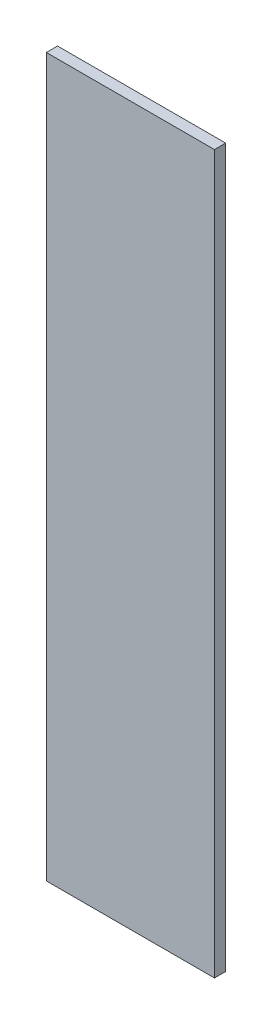
from build123d import *

# Parameters (mm, degrees)
SKETCH1_W           = 75
SKETCH1_H           = 320
BOSS_EXTRUDE1_DEPTH = 5


with BuildPart() as part:
    # Sketch1 → Boss-Extrude1 (new body)
    with BuildSketch(Plane.XY):
        Rectangle(SKETCH1_W, SKETCH1_H)
    extrude(amount=BOSS_EXTRUDE1_DEPTH)


solid = part.part
